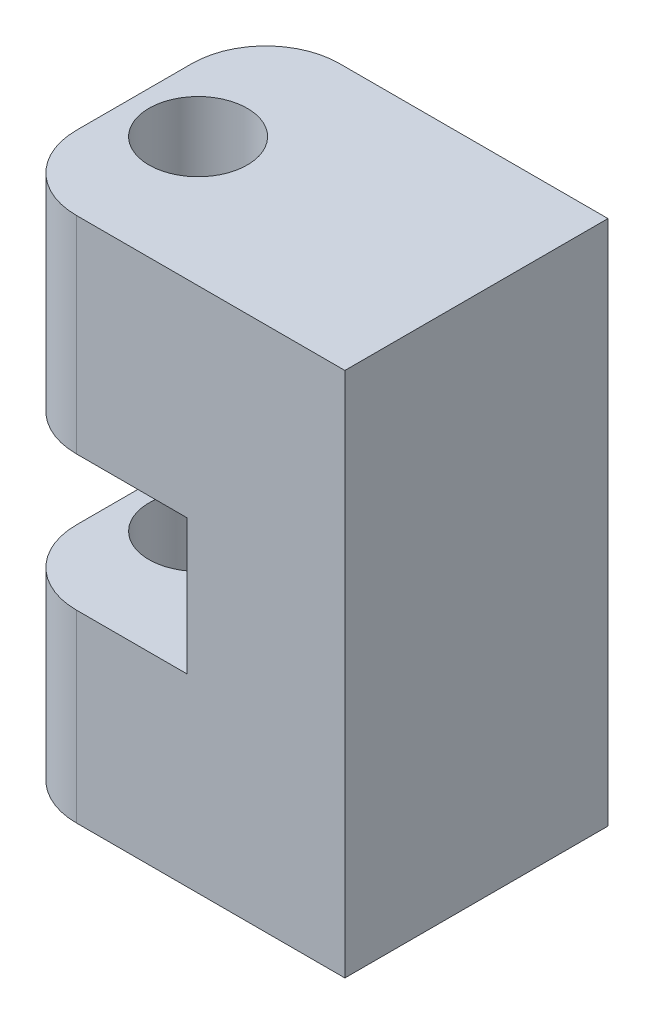
from build123d import *

# Parameters (mm, degrees)
BOSS_EXTRUDE4_DEPTH = 25.4
SKETCH3_R           = 2
CUT_EXTRUDE1_DEPTH  = 25.4
SKETCH5_W           = 54.299093249
SKETCH5_H           = 94.215662961
CUT_EXTRUDE2_DEPTH  = 4.5
SKETCH7_W           = 18.693193774
SKETCH7_H           = 5.5
CUT_EXTRUDE3_DEPTH  = 14.5
SKETCH9_W           = 36.111652001
SKETCH9_H           = 33.164105193
CUT_EXTRUDE4_DEPTH  = 1
SKETCH10_W          = 62.791660767
SKETCH10_H          = 37.243179947
CUT_EXTRUDE6_DEPTH  = 1
FILLET2_R           = 3
SKETCH11_W          = 10.7
SKETCH11_H          = 5.5
BOSS_EXTRUDE5_DEPTH = 2
SKETCH12_W          = 13.41826103
SKETCH12_H          = 56.552103836
CUT_EXTRUDE7_DEPTH  = 10
SKETCH14_W          = 10.7
SKETCH14_H          = 5.5
BOSS_EXTRUDE7_DEPTH = 2
SKETCH15_W          = 10.7
SKETCH15_H          = 9.5
BOSS_EXTRUDE8_DEPTH = 6
SKETCH16_W          = 10.7
SKETCH16_H          = 10.4
BOSS_EXTRUDE9_DEPTH = 6
FILLET3_R           = 3
SKETCH18_W          = 10.7
SKETCH18_H          = 5.5
CUT_EXTRUDE8_DEPTH  = 1
SKETCH21_W          = 35.797160714
SKETCH21_H          = 35.29022369
CUT_EXTRUDE9_DEPTH  = 3
SKETCH22_W          = 25.937316652
SKETCH22_H          = 36.458252548
CUT_EXTRUDE10_DEPTH = 2
SKETCH23_W          = 31.218703754
SKETCH23_H          = 37.872657663
CUT_EXTRUDE11_DEPTH = 2
SKETCH24_R          = 2
CUT_EXTRUDE12_DEPTH = 24


with BuildPart() as part:
    # Sketch1 → Boss-Extrude4 (new body)
    with BuildSketch(Plane(origin=(0, 0, 0), x_dir=(1, 0, 0), z_dir=(0, 1, 0))):
        with BuildLine():
            ThreePointArc((-5.100024486, 5.049332428), (-3.343059972, 1.197813276), (0.717280831, 0))
            Line((0.717280831, 0), (20.32, 0))
            Line((20.32, 0), (20.32, 12.7))
            Line((20.32, 12.7), (0.98359831, 12.7))
            ThreePointArc((0.98359831, 12.7), (-3.239897706, 11.634417694), (-5.100024486, 7.695723417))
            Line((-5.100024486, 7.695723417), (-5.100024486, 5.049332428))
        make_face()
        with BuildLine():
            ThreePointArc((0.089422705, 9.167796597), (0, 9.078373892), (-0.089422705, 9.167796597))
            Line((-0.089422705, 9.167796597), (-0.089422705, 9.317189397))
            ThreePointArc((-0.089422705, 9.317189397), (0, 9.406612102), (0.089422705, 9.317189397))
            Line((0.089422705, 9.317189397), (0.089422705, 9.167796597))
        make_face(mode=Mode.SUBTRACT)
    extrude(amount=BOSS_EXTRUDE4_DEPTH)

    # Sketch3 → Cut-Extrude1 (cut)
    with BuildSketch(Plane(origin=(0, 25.4, 0), x_dir=(1, 0, 0), z_dir=(0, 1, 0))):
        with Locations((0, 6.163356084)):
            Circle(SKETCH3_R)
    extrude(amount=-CUT_EXTRUDE1_DEPTH, mode=Mode.SUBTRACT)

    # Sketch5 → Cut-Extrude2 (cut)
    with BuildSketch(Plane(origin=(20.32, 0, 0), x_dir=(0, 0, -1), z_dir=(1, 0, 0))):
        with Locations((11.125522758, -8.280714776)):
            Rectangle(SKETCH5_W, SKETCH5_H)
    extrude(amount=-CUT_EXTRUDE2_DEPTH, mode=Mode.SUBTRACT)

    # Sketch7 → Cut-Extrude3 (cut)
    with BuildSketch(Plane.ZY.offset(5.100024486)):
        with Locations((-6.318501351, 12.25)):
            Rectangle(SKETCH7_W, SKETCH7_H)
    extrude(amount=-CUT_EXTRUDE3_DEPTH, mode=Mode.SUBTRACT)

    # Sketch9 → Cut-Extrude4 (cut)
    with BuildSketch(Plane(origin=(0, 0, -12.7), x_dir=(-1, 0, 0), z_dir=(0, 0, -1))):
        with Locations((-4.511590843, 12.177462725)):
            Rectangle(SKETCH9_W, SKETCH9_H)
    extrude(amount=-CUT_EXTRUDE4_DEPTH, mode=Mode.SUBTRACT)


with BuildPart() as body_2:
    # of the pieces the cut leaves, the one that is kept (cut_extrude4_keep)
    add(part.part.solids().sort_by_distance((-3.158483624, 0, -11.7))[0])

    # Sketch10 → Cut-Extrude6 (cut)
    with BuildSketch(Plane.XY):
        with Locations((3.132657463, 10.976513171)):
            Rectangle(SKETCH10_W, SKETCH10_H)
    extrude(amount=-CUT_EXTRUDE6_DEPTH, mode=Mode.SUBTRACT)


with BuildPart() as body_2_2:
    # of the pieces the cut leaves, the one that is kept (cut_extrude6_keep)
    add(body_2.part.solids().sort_by_distance((-3.158483624, 0, -11.7))[0])

    # Fillet2
    fillet2_edges = [body_2_2.edges().sort_by_distance(p)[0] for p in [
        (-3.100509095, 4.75, -1),
        (-3.100509095, 20.2, -1),
        (-3.158483624, 20.2, -11.7),
        (-3.158483624, 4.75, -11.7),
    ]]
    fillet(fillet2_edges, radius=FILLET2_R)

    # Sketch11 → Boss-Extrude5 (add)
    with BuildSketch(Plane.ZY.offset(-9.399975514)):
        with Locations((-6.35, 12.25)):
            Rectangle(SKETCH11_W, SKETCH11_H)
    extrude(amount=BOSS_EXTRUDE5_DEPTH)

    # Sketch12 → Cut-Extrude7 (cut)
    with BuildSketch(Plane.ZY.offset(5.100024486)):
        with Locations((-6.709130515, 16.674143704)):
            Rectangle(SKETCH12_W, SKETCH12_H)
    extrude(amount=-CUT_EXTRUDE7_DEPTH, mode=Mode.SUBTRACT)

    # Sketch14 → Boss-Extrude7 (add)
    with BuildSketch(Plane.ZY.offset(-7.399975514)):
        with Locations((-6.35, 12.25)):
            Rectangle(SKETCH14_W, SKETCH14_H)
    extrude(amount=BOSS_EXTRUDE7_DEPTH)

    # Sketch15 → Boss-Extrude8 (add)
    with BuildSketch(Plane.ZY.offset(-4.899975514)):
        with Locations((-6.35, 4.75)):
            Rectangle(SKETCH15_W, SKETCH15_H)
    extrude(amount=BOSS_EXTRUDE8_DEPTH)

    # Sketch16 → Boss-Extrude9 (add)
    with BuildSketch(Plane.ZY.offset(-4.899975514)):
        with Locations((-6.35, 20.2)):
            Rectangle(SKETCH16_W, SKETCH16_H)
    extrude(amount=BOSS_EXTRUDE9_DEPTH)

    # Fillet3
    fillet3_edges = [body_2_2.edges().sort_by_distance(p)[0] for p in [
        (-1.100024486, 20.2, -1),
        (-1.100024486, 20.2, -11.7),
        (-1.100024486, 4.75, -11.7),
        (-1.100024486, 4.75, -1),
    ]]
    fillet(fillet3_edges, radius=FILLET3_R)

    # Sketch18 → Cut-Extrude8 (cut)
    with BuildSketch(Plane.ZY.offset(-5.399975514)):
        with Locations((-6.35, 12.25)):
            Rectangle(SKETCH18_W, SKETCH18_H)
    extrude(amount=-CUT_EXTRUDE8_DEPTH, mode=Mode.SUBTRACT)

    # Sketch21 → Cut-Extrude9 (cut)
    with BuildSketch(Plane(origin=(15.82, 0, 0), x_dir=(0, 0, -1), z_dir=(1, 0, 0))):
        with Locations((4.247356295, 13.050264646)):
            Rectangle(SKETCH21_W, SKETCH21_H)
    extrude(amount=-CUT_EXTRUDE9_DEPTH, mode=Mode.SUBTRACT)

    # Sketch22 → Cut-Extrude10 (cut)
    with BuildSketch(Plane(origin=(0, 25.4, 0), x_dir=(1, 0, 0), z_dir=(0, 1, 0))):
        with Locations((4.63538262, 4.299284276)):
            Rectangle(SKETCH22_W, SKETCH22_H)
    extrude(amount=-CUT_EXTRUDE10_DEPTH, mode=Mode.SUBTRACT)

    # Sketch23 → Cut-Extrude11 (cut)
    with BuildSketch(Plane.XZ):
        with Locations((9.360738883, -6.802201309)):
            Rectangle(SKETCH23_W, SKETCH23_H)
    extrude(amount=-CUT_EXTRUDE11_DEPTH, mode=Mode.SUBTRACT)

    # Sketch24 → Cut-Extrude12 (cut)
    with BuildSketch(Plane.XZ.offset(-2)):
        with Locations((1.599975514, -6.25)):
            Circle(SKETCH24_R)
    extrude(amount=-CUT_EXTRUDE12_DEPTH, mode=Mode.SUBTRACT)


solid = body_2_2.part
